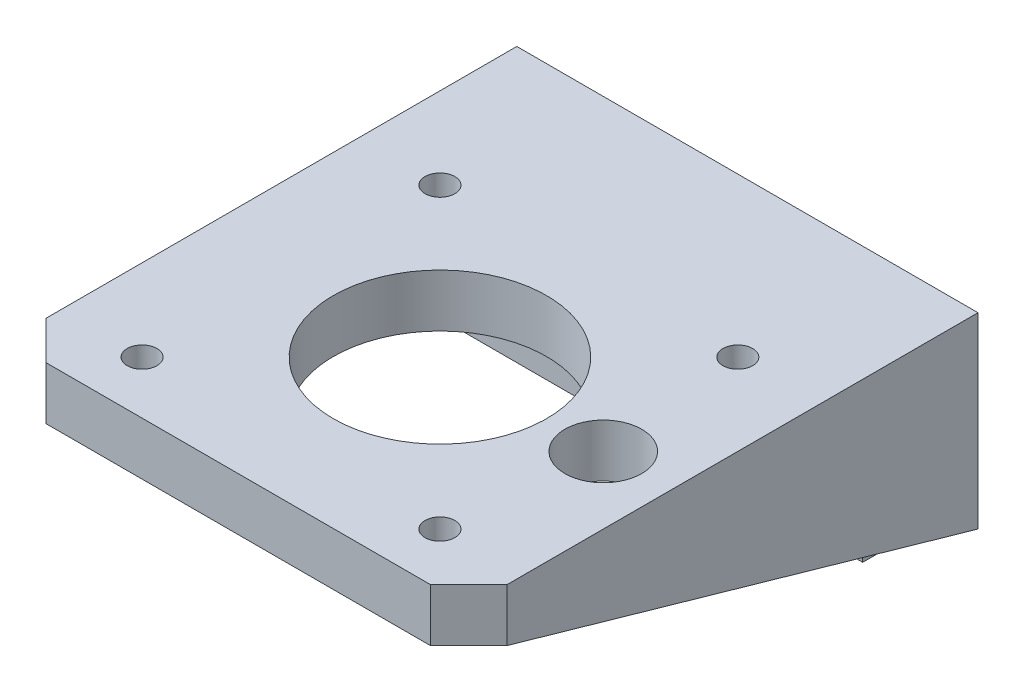
from build123d import *

# Parameters (mm, degrees)
CROQUIS1_R              = 1.55
CROQUIS1_R_2            = 11.1
CROQUIS1_R_3            = 4
SALIENTE_EXTRUIR1_DEPTH = 5.5
SALIENTE_EXTRUIR2_DEPTH = 5.5
SALIENTE_EXTRUIR3_DEPTH = 3
SALIENTE_EXTRUIR4_DEPTH = 5.5
SALIENTE_EXTRUIR5_DEPTH = 3
CROQUIS7_W              = 42
CROQUIS7_H              = 9
SALIENTE_EXTRUIR6_DEPTH = 14
CROQUIS9_R              = 1.55
CORTAR_EXTRUIR1_DEPTH   = 6
CROQUIS10_R             = 2.8
CROQUIS10_R_2           = 1.55
CORTAR_EXTRUIR2_DEPTH   = 3


with BuildPart() as part:
    # Croquis1 → Saliente-Extruir1 (new body)
    with BuildSketch(Plane(origin=(0, 0, 0), x_dir=(1, 0, 0), z_dir=(0, 1, 0))):
        Polygon((0, 4), (0, 49), (4, 53), (44, 53), (48, 49), (48, 4), (44, 0), (4, 0), align=None)
        with Locations((8.5, 36.5)):
            Circle(CROQUIS1_R, mode=Mode.SUBTRACT)
        with Locations((39.5, 36.5)):
            Circle(CROQUIS1_R, mode=Mode.SUBTRACT)
        with Locations((8.5, 5.5)):
            Circle(CROQUIS1_R, mode=Mode.SUBTRACT)
        with Locations((39.5, 5.5)):
            Circle(CROQUIS1_R, mode=Mode.SUBTRACT)
        with Locations((24, 21)):
            Circle(CROQUIS1_R_2, mode=Mode.SUBTRACT)
        with Locations((41, 21)):
            Circle(CROQUIS1_R_3, mode=Mode.SUBTRACT)
    extrude(amount=SALIENTE_EXTRUIR1_DEPTH)

    # Croquis3 → Saliente-Extruir2 (add)
    with BuildSketch(Plane(origin=(0, 5.5, 0), x_dir=(1, 0, 0), z_dir=(0, 1, 0))):
        Polygon((4, 53), (0, 53), (0, 49), align=None)
    extrude(amount=-SALIENTE_EXTRUIR2_DEPTH)

    # Croquis4 → Saliente-Extruir3 (add)
    with BuildSketch(Plane.ZY):
        Polygon((-53, 0), (-53, 5.5), (-4, 5.5), (-4, 0), (-53, -14), align=None)
    extrude(amount=-SALIENTE_EXTRUIR3_DEPTH)

    # Croquis5 → Saliente-Extruir4 (add)
    with BuildSketch(Plane(origin=(0, 5.5, 0), x_dir=(1, 0, 0), z_dir=(0, 1, 0))):
        Polygon((48, 49), (48, 53), (44, 53), align=None)
    extrude(amount=-SALIENTE_EXTRUIR4_DEPTH)

    # Croquis6 → Saliente-Extruir5 (add)
    with BuildSketch(Plane(origin=(48, 0, 0), x_dir=(0, 0, -1), z_dir=(1, 0, 0))):
        Polygon((4, 5.5), (4, 0), (53, -14), (53, 0), (53, 5.5), align=None)
    extrude(amount=-SALIENTE_EXTRUIR5_DEPTH)

    # Croquis7 → Saliente-Extruir6 (add)
    with BuildSketch(Plane.XZ):
        with Locations((24, -48.5)):
            Rectangle(CROQUIS7_W, CROQUIS7_H)
    extrude(amount=SALIENTE_EXTRUIR6_DEPTH)

    # Croquis9 → Cortar-Extruir1 (cut)
    with BuildSketch(Plane.XY.offset(-44)):
        with Locations((9, -5.714285714)):
            Circle(CROQUIS9_R)
        with Locations((39, -5.714285714)):
            Circle(CROQUIS9_R)
    extrude(amount=-CORTAR_EXTRUIR1_DEPTH, mode=Mode.SUBTRACT)

    # Croquis10 → Cortar-Extruir2 (cut)
    # profile 1 of 2: a face of its own
    with BuildSketch(Plane.XY.offset(-44)):
        with Locations((9, -5.714285714)):
            Circle(CROQUIS10_R)
        with Locations((9, -5.714285714)):
            Circle(CROQUIS10_R_2, mode=Mode.SUBTRACT)
    # profile 2 of 2: a face of its own
    with BuildSketch(Plane.XY.offset(-44)):
        with Locations((39, -5.714285714)):
            Circle(CROQUIS10_R)
        with Locations((39, -5.714285714)):
            Circle(CROQUIS10_R_2, mode=Mode.SUBTRACT)
    extrude(amount=-CORTAR_EXTRUIR2_DEPTH, mode=Mode.SUBTRACT)


solid = part.part
